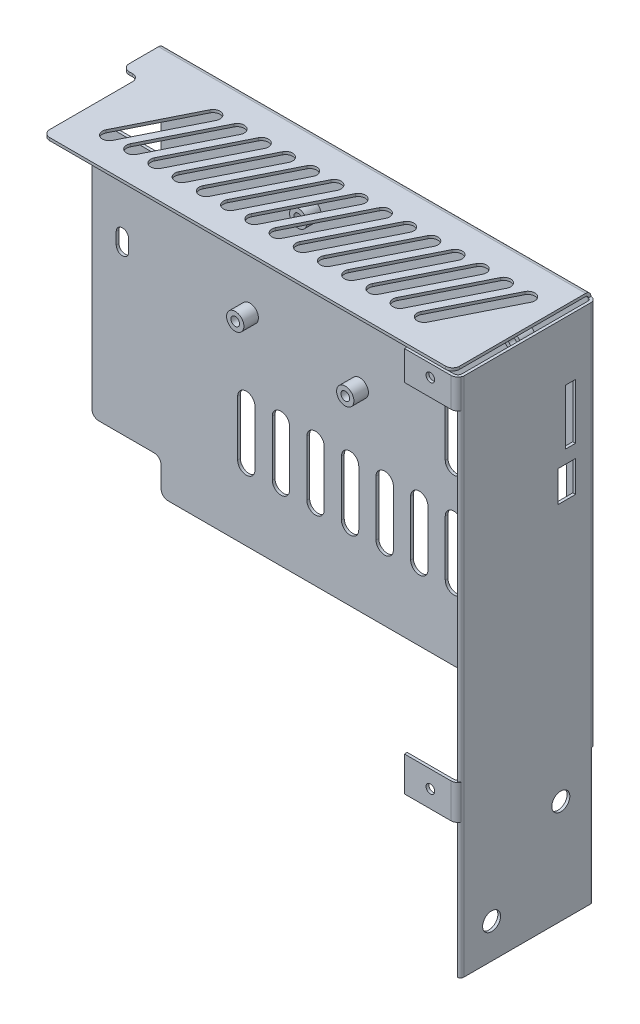
from build123d import *

# Parameters (mm, degrees)
SALIENTE_EXTRUIR1_DEPTH      = 0.8
CORTAR_EXTRUIR7_DEPTH        = 100.833907493
MATRIZL1_COUNT               = 10
MATRIZL1_PITCH               = 10
CORTAR_EXTRUIR9_DEPTH        = 0.8
MATRIZL2_COUNT               = 4
MATRIZL2_PITCH               = 10
CORTAR_EXTRUIR10_DEPTH       = 0.8
CROQUIS9_R                   = 2.5
CROQUIS9_R_2                 = 1.25
SALIENTE_EXTRUIR2_DEPTH      = 5
SALIENTE_EXTRUIR3_DEPTH      = 123.4634
CROQUIS13_W                  = 5
CROQUIS13_H                  = 27.96
CORTAR_EXTRUIR11_DEPTH       = 123.471
REDONDEO1_R                  = 2
CORTAR_EXTRUIR12_DEPTH       = 123.471
MATRIZL3_COUNT               = 14
MATRIZL3_PITCH               = 7
SALIENTE_EXTRUIR4_DEPTH      = 39
SALIENTE_EXTRUIR4_DEPTH_BACK = 111.49289322
CROQUIS16_R                  = 2.6
CORTAR_EXTRUIR13_DEPTH       = 111.49289322
CROQUIS17_W                  = 2.9
CROQUIS17_H                  = 16
CROQUIS17_W_2                = 5.1
CROQUIS17_H_2                = 9
CORTAR_EXTRUIR14_DEPTH       = 111.49289322
SALIENTE_EXTRUIR5_DEPTH      = 8.5
SALIENTE_EXTRUIR6_START      = 10
SALIENTE_EXTRUIR6_DEPTH      = 10
CORTAR_EXTRUIR16_DEPTH       = 1
CROQUIS21_R                  = 1.25
CORTAR_EXTRUIR17_DEPTH       = 1
REDONDEO2_R                  = 2
REDONDEO3_START              = -97
REDONDEO3_DEPTH              = 40.258208778
REDONDEO4_R                  = 1


with BuildPart() as part:
    # Croquis1 → Saliente-Extruir1 (new body)
    with BuildSketch(Plane.XY):
        Polygon((-62.137313167, 54.721608778), (61.326086833, 54.751101997), (61.326086833, -56.741791222), (-62.137313167, -56.741791222), (-62.137313167, -46.741791222), (-82.137313167, -46.741791222), (-82.137313167, 28.258208778), (-62.137313167, 28.258208778), align=None)
    extrude(amount=SALIENTE_EXTRUIR1_DEPTH)

    # Croquis6 → Cortar-Extruir7 (cut, through all)
    with BuildSketch(Plane.XY):
        with BuildLine():
            Line((-40, -20.5), (-40, -36.5))
            ThreePointArc((-40, -36.5), (-37.5, -39), (-35, -36.5))
            Line((-35, -36.5), (-35, -20.5))
            ThreePointArc((-35, -20.5), (-37.5, -18), (-40, -20.5))
        make_face()
    cortar_extruir7 = extrude(amount=CORTAR_EXTRUIR7_DEPTH, mode=Mode.SUBTRACT)

    # MatrizL1: Cortar-Extruir7 ×10
    with Locations(*[(i * MATRIZL1_PITCH, 0, 0) for i in range(1, MATRIZL1_COUNT)]):
        add(cortar_extruir7, mode=Mode.SUBTRACT)

    # Croquis7 → Cortar-Extruir9 (cut)
    with BuildSketch(Plane.XY):
        with BuildLine():
            Line((20, 9.5), (20, -6.5))
            ThreePointArc((20, -6.5), (22.5, -9), (25, -6.5))
            Line((25, -6.5), (25, 9.5))
            ThreePointArc((25, 9.5), (22.5, 12), (20, 9.5))
        make_face()
    cortar_extruir9 = extrude(amount=CORTAR_EXTRUIR9_DEPTH, mode=Mode.SUBTRACT)

    # MatrizL2: Cortar-Extruir9 ×4
    with Locations(*[(i * MATRIZL2_PITCH, 0, 0) for i in range(1, MATRIZL2_COUNT)]):
        add(cortar_extruir9, mode=Mode.SUBTRACT)

    # Croquis8 → Cortar-Extruir10 (cut)
    with BuildSketch(Plane.XY):
        with BuildLine():
            Line((-75.1, 3.2), (-75.1, -0.2))
            ThreePointArc((-75.1, -0.2), (-73.3, -2), (-71.5, -0.2))
            Line((-71.5, -0.2), (-71.5, 3.2))
            ThreePointArc((-71.5, 3.2), (-73.3, 5), (-75.1, 3.2))
        make_face()
    extrude(amount=CORTAR_EXTRUIR10_DEPTH, mode=Mode.SUBTRACT)

    # Croquis9 → Saliente-Extruir2 (add)
    # profile 1 of 4: a face of its own
    with BuildSketch(Plane.XY):
        with Locations((-36.5, 2.1)):
            Circle(CROQUIS9_R)
        with Locations((-36.5, 2.1)):
            Circle(CROQUIS9_R_2, mode=Mode.SUBTRACT)
    # profile 2 of 4: a face of its own
    with BuildSketch(Plane.XY):
        with Locations((-18.3, 37)):
            Circle(CROQUIS9_R)
        with Locations((-18.3, 37)):
            Circle(CROQUIS9_R_2, mode=Mode.SUBTRACT)
    # profile 3 of 4: a face of its own
    with BuildSketch(Plane.XY):
        with Locations((43.7, 37)):
            Circle(CROQUIS9_R)
        with Locations((43.7, 37)):
            Circle(CROQUIS9_R_2, mode=Mode.SUBTRACT)
    # profile 4 of 4: a face of its own
    with BuildSketch(Plane.XY):
        with Locations((-4.7, -0.7)):
            Circle(CROQUIS9_R)
        with Locations((-4.7, -0.7)):
            Circle(CROQUIS9_R_2, mode=Mode.SUBTRACT)
    extrude(amount=SALIENTE_EXTRUIR2_DEPTH)

    # Croquis15 → Saliente-Extruir4 (add, two sides: drawn at the far end of the back side and taken through both)
    with BuildSketch(Plane(origin=(0, -56.741791222, 0), x_dir=(-1, 0, 0), z_dir=(0, -1, 0)).offset(-SALIENTE_EXTRUIR4_DEPTH_BACK)):
        with BuildLine():
            Line((-61.326086833, -0.8), (-61.326086833, 0))
            ThreePointArc((-61.326086833, 0), (-62.415031276, -0.451055557), (-62.866086833, -1.54))
            Line((-62.866086833, -1.54), (-62.866086833, -39.26062567))
            Line((-62.866086833, -39.26062567), (-62.066086833, -39.26062567))
            Line((-62.066086833, -39.26062567), (-62.066086833, -1.54))
            ThreePointArc((-62.066086833, -1.54), (-61.849345851, -1.016740982), (-61.326086833, -0.8))
        make_face()
    extrude(amount=SALIENTE_EXTRUIR4_DEPTH + SALIENTE_EXTRUIR4_DEPTH_BACK)

    # Croquis16 → Cortar-Extruir13 (cut)
    with BuildSketch(Plane(origin=(62.866086833, 0, 0), x_dir=(0, 0, -1), z_dir=(1, 0, 0))):
        with Locations(Location((-30.26062567, -85.741791222, 0), (0, 0, 90))):
            Circle(CROQUIS16_R)
        with Locations(Location((-10.26062567, -65.741791222, 0), (0, 0, 90))):
            Circle(CROQUIS16_R)
    extrude(amount=-CORTAR_EXTRUIR13_DEPTH, mode=Mode.SUBTRACT)

    # Croquis17 → Cortar-Extruir14 (cut)
    with BuildSketch(Plane(origin=(62.866086833, 0, 0), x_dir=(0, 0, -1), z_dir=(1, 0, 0))):
        with Locations((-7.45, 29.751101998)):
            Rectangle(CROQUIS17_W, CROQUIS17_H)
        with Locations((-8.55, 13.451101998)):
            Rectangle(CROQUIS17_W_2, CROQUIS17_H_2)
    extrude(amount=-CORTAR_EXTRUIR14_DEPTH, mode=Mode.SUBTRACT)

    # Croquis18 → Saliente-Extruir5 (add)
    with BuildSketch(Plane(origin=(0, 54.751101998, 0), x_dir=(1, 0, 0), z_dir=(0, 1, 0))):
        with BuildLine():
            Line((62.066086833, -38), (62.866086833, -38))
            ThreePointArc((62.866086833, -38), (62.280300395, -39.414213562), (60.866086833, -40))
            Line((60.866086833, -40), (47.406086833, -40))
            Line((47.406086833, -40), (47.406086833, -39.2))
            Line((47.406086833, -39.2), (60.866086833, -39.2))
            ThreePointArc((60.866086833, -39.2), (61.71461497, -38.848528137), (62.066086833, -38))
        make_face()
    extrude(amount=-SALIENTE_EXTRUIR5_DEPTH)

    # Croquis20 → Saliente-Extruir6 (add)
    with BuildSketch(Plane(origin=(0, -56.741791222, 0), x_dir=(1, 0, 0), z_dir=(0, 1, 0)).offset(SALIENTE_EXTRUIR6_START)):
        with BuildLine():
            Line((62.066086833, -38), (62.866086833, -38))
            ThreePointArc((62.866086833, -38), (62.280300395, -39.414213562), (60.866086833, -40))
            Line((60.866086833, -40), (47.406086833, -40))
            Line((47.406086833, -40), (47.406086833, -39.2))
            Line((47.406086833, -39.2), (60.866086833, -39.2))
            ThreePointArc((60.866086833, -39.2), (61.71461497, -38.848528137), (62.066086833, -38))
        make_face()
    extrude(amount=-SALIENTE_EXTRUIR6_DEPTH)

    # Croquis22 → Cortar-Extruir16 (cut)
    with BuildSketch(Plane.ZY.offset(-62.066086833)):
        Polygon((1.54, -98.816591783), (1.54, -56.741791222), (-3.189793911, -56.741791222), (-3.189793911, -98.792897822), align=None)
    extrude(amount=CORTAR_EXTRUIR16_DEPTH, mode=Mode.SUBTRACT)

    # Croquis21 → Cortar-Extruir17 (cut)
    with BuildSketch(Plane.XY.offset(40)):
        with Locations((54.906086833, 51.251101998)):
            Circle(CROQUIS21_R)
        with Locations((54.906086833, -51.741791222)):
            Circle(CROQUIS21_R)
    extrude(amount=-CORTAR_EXTRUIR17_DEPTH, mode=Mode.SUBTRACT)

    # Redondeo2
    redondeo2_edges = [part.edges().sort_by_distance(p)[0] for p in [
        (-82.137313167, 28.258208778, 0.4),
        (-82.137313167, -46.741791222, 0.4),
        (-62.137313167, -46.741791222, 0.4),
        (-62.137313167, -56.741791222, 0.4),
        (-62.137313167, 28.258208778, 0.4),
    ]]
    fillet(redondeo2_edges, radius=REDONDEO2_R)

    # Redondeo3: read off the stored shape, not the designer's step
    # Redondeo3 outline → Redondeo3 (cut)
    with BuildSketch(Plane(origin=(0, 0, 0), x_dir=(1, 0, 0), z_dir=(0, 1, 0)).offset(REDONDEO3_START)):
        with BuildLine():
            ThreePointArc((62.066086833, -1.54), (62.466086833, -1.14), (62.866086833, -1.54))
            ThreePointArc((62.866086833, -1.54), (62.651077399, -0.755143325), (62.066086833, -0.189444559))
            Line((62.066086833, -0.189444559), (62.066086833, -1.54))
        make_face()
    extrude(amount=REDONDEO3_DEPTH, mode=Mode.SUBTRACT)

    # Redondeo4
    # the kernel refuses this fillet: 1 mm, written as the material it takes off along each edge
    with BuildSketch(Plane(origin=(62.866086833, 57.200591741, 39.26062567), x_dir=(0, 0, -1), z_dir=(0, -1, 0))) as redondeo4_piece_1_section:
        with BuildLine():
            CenterArc((0.979795897, -1), REDONDEO4_R, 90, 78.463040967)
            Line((0, -0.8), (-0.019595918, -0.796))
            ThreePointArc((-0.019595918, -0.796), (-0.02, -0.4), (-0.02, 0))
            Line((-0.02, 0), (0, 0.02))
            Line((0, 0.02), (0.979795897, 0.02))
            Line((0.979795897, 0.02), (0.979795897, 0))
        make_face()
    redondeo4_piece_1 = extrude(amount=155.391872706, mode=Mode.PRIVATE)
    redondeo4_piece_1 = redondeo4_piece_1 - Plane(origin=(60.866086833, 57.200591741, 38), x_dir=(1, 0, 0), z_dir=(0, 1, 0)) * Cylinder(2, 315, mode=Mode.PRIVATE)
    redondeo4_piece_1 = split(redondeo4_piece_1, bisect_by=Plane(origin=(62.866086833, 46.251101998, 39.26062567), z_dir=(0, 1, 0)), keep=Keep.TOP, mode=Mode.PRIVATE)
    add(redondeo4_piece_1, mode=Mode.SUBTRACT)
    with BuildSketch(Plane(origin=(62.866086833, 57.200591741, 39.26062567), x_dir=(0, 0, -1), z_dir=(0, -1, 0))) as redondeo4_piece_2_section:
        with BuildLine():
            CenterArc((0.979795897, -1), REDONDEO4_R, 90, 78.463040967)
            Line((0, -0.8), (-0.019595918, -0.796))
            ThreePointArc((-0.019595918, -0.796), (-0.02, -0.4), (-0.02, 0))
            Line((-0.02, 0), (0, 0.02))
            Line((0, 0.02), (0.979795897, 0.02))
            Line((0.979795897, 0.02), (0.979795897, 0))
        make_face()
    redondeo4_piece_2 = extrude(amount=155.391872706, mode=Mode.PRIVATE)
    redondeo4_piece_2 = redondeo4_piece_2 - Plane(origin=(60.866086833, 57.200591741, 38), x_dir=(1, 0, 0), z_dir=(0, 1, 0)) * Cylinder(2, 315, mode=Mode.PRIVATE)
    redondeo4_piece_2 = split(redondeo4_piece_2, bisect_by=Plane(origin=(62.866086833, 46.251101998, 39.26062567), z_dir=(0, -1, 0)), keep=Keep.TOP, mode=Mode.PRIVATE)
    redondeo4_piece_2 = split(redondeo4_piece_2, bisect_by=Plane(origin=(62.866086833, -46.741791222, 39.26062567), z_dir=(0, 1, 0)), keep=Keep.TOP, mode=Mode.PRIVATE)
    add(redondeo4_piece_2, mode=Mode.SUBTRACT)
    with BuildSketch(Plane(origin=(62.866086833, 57.200591741, 39.26062567), x_dir=(0, 0, -1), z_dir=(0, -1, 0))) as redondeo4_piece_3_section:
        with BuildLine():
            CenterArc((0.979795897, -1), REDONDEO4_R, 90, 78.463040967)
            Line((0, -0.8), (-0.019595918, -0.796))
            ThreePointArc((-0.019595918, -0.796), (-0.02, -0.4), (-0.02, 0))
            Line((-0.02, 0), (0, 0.02))
            Line((0, 0.02), (0.979795897, 0.02))
            Line((0.979795897, 0.02), (0.979795897, 0))
        make_face()
    redondeo4_piece_3 = extrude(amount=155.391872706, mode=Mode.PRIVATE)
    redondeo4_piece_3 = redondeo4_piece_3 & Plane(origin=(60.866086833, 57.200591741, 38), x_dir=(1, 0, 0), z_dir=(0, 1, 0)) * Cylinder(2, 315, mode=Mode.PRIVATE)
    redondeo4_piece_3 = split(redondeo4_piece_3, bisect_by=Plane(origin=(62.866086833, 46.251101998, 39.26062567), z_dir=(0, -1, 0)), keep=Keep.TOP, mode=Mode.PRIVATE)
    redondeo4_piece_3 = split(redondeo4_piece_3, bisect_by=Plane(origin=(62.866086833, -46.741791222, 39.26062567), z_dir=(0, 1, 0)), keep=Keep.TOP, mode=Mode.PRIVATE)
    add(redondeo4_piece_3, mode=Mode.SUBTRACT)
    with BuildSketch(Plane(origin=(62.866086833, 57.200591741, 39.26062567), x_dir=(0, 0, -1), z_dir=(0, -1, 0))) as redondeo4_piece_4_section:
        with BuildLine():
            CenterArc((0.979795897, -1), REDONDEO4_R, 90, 78.463040967)
            Line((0, -0.8), (-0.019595918, -0.796))
            ThreePointArc((-0.019595918, -0.796), (-0.02, -0.4), (-0.02, 0))
            Line((-0.02, 0), (0, 0.02))
            Line((0, 0.02), (0.979795897, 0.02))
            Line((0.979795897, 0.02), (0.979795897, 0))
        make_face()
    redondeo4_piece_4 = extrude(amount=155.391872706, mode=Mode.PRIVATE)
    redondeo4_piece_4 = redondeo4_piece_4 - Plane(origin=(60.866086833, 57.200591741, 38), x_dir=(1, 0, 0), z_dir=(0, 1, 0)) * Cylinder(2, 315, mode=Mode.PRIVATE)
    redondeo4_piece_4 = split(redondeo4_piece_4, bisect_by=Plane(origin=(62.866086833, -46.741791222, 39.26062567), z_dir=(0, -1, 0)), keep=Keep.TOP, mode=Mode.PRIVATE)
    redondeo4_piece_4 = split(redondeo4_piece_4, bisect_by=Plane(origin=(62.866086833, -56.741791222, 39.26062567), z_dir=(0, 1, 0)), keep=Keep.TOP, mode=Mode.PRIVATE)
    add(redondeo4_piece_4, mode=Mode.SUBTRACT)
    with BuildSketch(Plane(origin=(62.866086833, 57.200591741, 39.26062567), x_dir=(0, 0, -1), z_dir=(0, -1, 0))) as redondeo4_piece_5_section:
        with BuildLine():
            CenterArc((0.979795897, -1), REDONDEO4_R, 90, 78.463040967)
            Line((0, -0.8), (-0.019595918, -0.796))
            ThreePointArc((-0.019595918, -0.796), (-0.02, -0.4), (-0.02, 0))
            Line((-0.02, 0), (0, 0.02))
            Line((0, 0.02), (0.979795897, 0.02))
            Line((0.979795897, 0.02), (0.979795897, 0))
        make_face()
    redondeo4_piece_5 = extrude(amount=155.391872706, mode=Mode.PRIVATE)
    redondeo4_piece_5 = redondeo4_piece_5 - Plane(origin=(60.866086833, 57.200591741, 38), x_dir=(1, 0, 0), z_dir=(0, 1, 0)) * Cylinder(2, 315, mode=Mode.PRIVATE)
    redondeo4_piece_5 = split(redondeo4_piece_5, bisect_by=Plane(origin=(62.866086833, -56.741791222, 39.26062567), z_dir=(0, -1, 0)), keep=Keep.TOP, mode=Mode.PRIVATE)
    add(redondeo4_piece_5, mode=Mode.SUBTRACT)
    with BuildSketch(Plane(origin=(62.866086833, 57.200591741, 39.26062567), x_dir=(0, 0, -1), z_dir=(0, -1, 0))) as redondeo4_piece_6_section:
        with BuildLine():
            CenterArc((0.979795897, -1), REDONDEO4_R, 90, 78.463040967)
            Line((0, -0.8), (-0.019595918, -0.796))
            ThreePointArc((-0.019595918, -0.796), (-0.02, -0.4), (-0.02, 0))
            Line((-0.02, 0), (0, 0.02))
            Line((0, 0.02), (0.979795897, 0.02))
            Line((0.979795897, 0.02), (0.979795897, 0))
        make_face()
    redondeo4_piece_6 = extrude(amount=155.391872706, mode=Mode.PRIVATE)
    redondeo4_piece_6 = redondeo4_piece_6 & Plane(origin=(60.866086833, 57.200591741, 38), x_dir=(1, 0, 0), z_dir=(0, 1, 0)) * Cylinder(2, 315, mode=Mode.PRIVATE)
    redondeo4_piece_6 = split(redondeo4_piece_6, bisect_by=Plane(origin=(62.866086833, -56.741791222, 39.26062567), z_dir=(0, -1, 0)), keep=Keep.TOP, mode=Mode.PRIVATE)
    add(redondeo4_piece_6, mode=Mode.SUBTRACT)


with BuildPart() as body_2:
    # Croquis12 → Saliente-Extruir3 (new body)
    with BuildSketch(Plane(origin=(61.326086833, 0, 0), x_dir=(0, 0, -1), z_dir=(1, 0, 0))):
        with BuildLine():
            Line((-0.8, 54.751101997), (0, 54.751101997))
            ThreePointArc((0, 54.751101997), (-0.451055557, 55.84004644), (-1.54, 56.291101997))
            Line((-1.54, 56.291101997), (-40, 56.291101997))
            Line((-40, 56.291101997), (-40, 55.491101997))
            Line((-40, 55.491101997), (-1.54, 55.491101997))
            ThreePointArc((-1.54, 55.491101997), (-1.016740982, 55.274361015), (-0.8, 54.751101997))
        make_face()
    extrude(amount=-SALIENTE_EXTRUIR3_DEPTH)

    # Croquis13 → Cortar-Extruir11 (cut)
    with BuildSketch(Plane(origin=(0, 56.291101997, 0), x_dir=(1, 0, 0), z_dir=(0, 1, 0))):
        with Locations((-59.637313167, -26.02)):
            Rectangle(CROQUIS13_W, CROQUIS13_H)
    extrude(amount=-CORTAR_EXTRUIR11_DEPTH, mode=Mode.SUBTRACT)

    # Redondeo1
    redondeo1_edges = [body_2.edges().sort_by_distance(p)[0] for p in [
        (-62.137313167, 55.891101997, 12.04),
        (-57.137313167, 55.891101997, 40),
        (-57.137313167, 55.891101997, 12.04),
        (61.326086833, 55.891101997, 40),
    ]]
    fillet(redondeo1_edges, radius=REDONDEO1_R)

    # Croquis14 → Cortar-Extruir12 (cut)
    with BuildSketch(Plane(origin=(0, 56.291101997, 0), x_dir=(1, 0, 0), z_dir=(0, 1, 0))):
        with BuildLine():
            Line((-45.348458785, -31.664427191), (-35.348458785, -11.664427191))
            ThreePointArc((-35.348458785, -11.664427191), (-36.242885976, -8.981145618), (-38.926167549, -9.875572809))
            Line((-38.926167549, -9.875572809), (-48.926167549, -29.875572809))
            ThreePointArc((-48.926167549, -29.875572809), (-48.031740358, -32.558854382), (-45.348458785, -31.664427191))
        make_face()
    cortar_extruir12 = extrude(amount=-CORTAR_EXTRUIR12_DEPTH, mode=Mode.SUBTRACT)

    # MatrizL3: Cortar-Extruir12 ×14
    with Locations(*[(i * MATRIZL3_PITCH, 0, 0) for i in range(1, MATRIZL3_COUNT)]):
        add(cortar_extruir12, mode=Mode.SUBTRACT)


solid = Compound([part.part, body_2.part])
